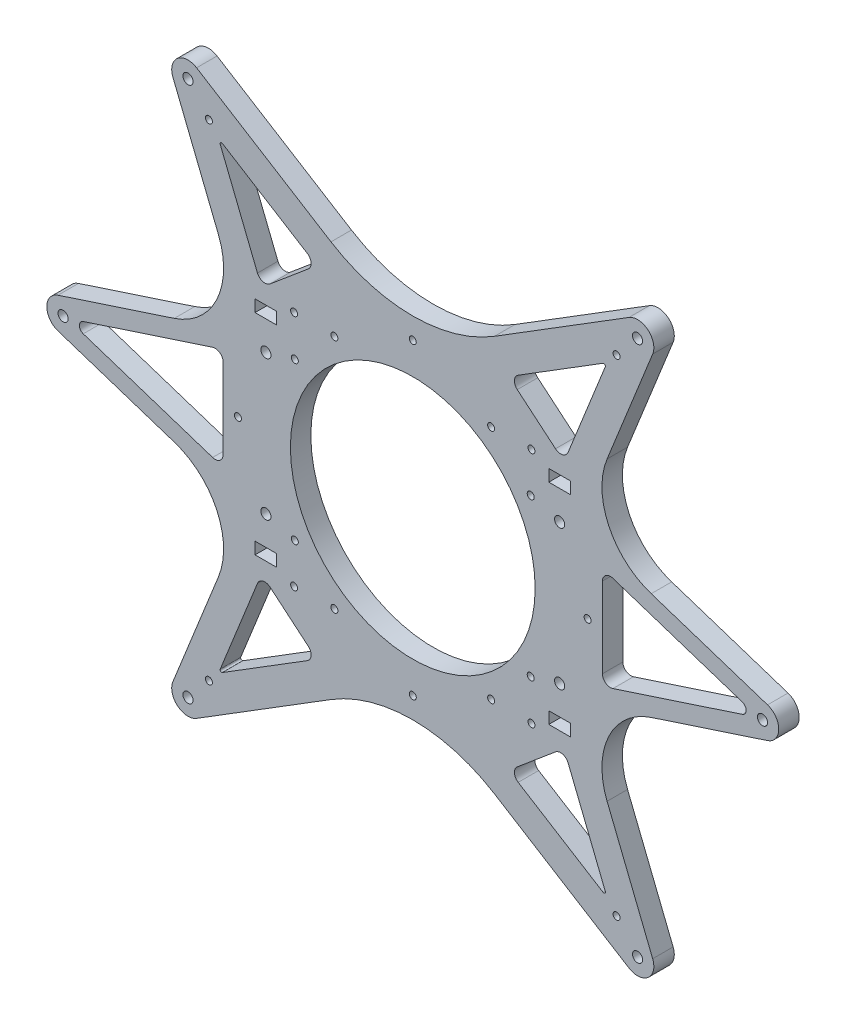
from build123d import *

# Parameters (mm, degrees)
SKETCH1_R           = 1.450000006
SKETCH1_R_2         = 1
SKETCH1_R_3         = 1.45
SKETCH1_R_4         = 35
SKETCH1_W           = 6.2
SKETCH1_H           = 3.4
BOSS_EXTRUDE1_DEPTH = 5.85


with BuildPart() as part:
    # Sketch1 → Boss-Extrude1 (new body)
    with BuildSketch(Plane.XY):
        with BuildLine():
            Line((587.995290395, 497.753361998), (601.026388312, 465.269666287))
            ThreePointArc((601.026388312, 465.269666287), (600.580353033, 449.003385667), (588.406365105, 438.205939183))
            Line((588.406365105, 438.205939183), (555.146182231, 427.30822221))
            ThreePointArc((555.146182231, 427.30822221), (551.939243509, 422.882775531), (555.146182231, 418.457328853))
            Line((555.146182231, 418.457328853), (588.406366938, 407.559611279))
            ThreePointArc((588.406366938, 407.559611279), (600.58035448, 396.762164902), (601.026389221, 380.495884628))
            Line((601.026389221, 380.495884628), (587.995289899, 348.01218948))
            ThreePointArc((587.995289899, 348.01218948), (589.32399836, 342.710908714), (594.775468563, 342.322944064))
            Line((594.775468563, 342.322944064), (633.210915705, 366.208380082))
            ThreePointArc((633.210915705, 366.208380082), (644.436635852, 371.1815144), (656.596182238, 372.882775531))
            ThreePointArc((656.596182238, 372.882775531), (668.755728624, 371.181514399), (679.981448771, 366.208380082))
            Line((679.981448771, 366.208380082), (718.416895913, 342.322944064))
            ThreePointArc((718.416895913, 342.322944064), (723.868366115, 342.710908714), (725.197074576, 348.01218948))
            Line((725.197074576, 348.01218948), (712.165975255, 380.495884628))
            ThreePointArc((712.165975255, 380.495884628), (712.612009996, 396.762164902), (724.785997538, 407.559611279))
            Line((724.785997538, 407.559611279), (758.046182244, 418.457328853))
            ThreePointArc((758.046182244, 418.457328853), (761.253120966, 422.882775531), (758.046182244, 427.30822221))
            Line((758.046182244, 427.30822221), (724.785999371, 438.205939183))
            ThreePointArc((724.785999371, 438.205939183), (712.612011443, 449.003385667), (712.165976164, 465.269666287))
            Line((712.165976164, 465.269666287), (725.197074081, 497.753361998))
            ThreePointArc((725.197074081, 497.753361998), (723.86836572, 503.054641878), (718.416896408, 503.442606583))
            Line((718.416896408, 503.442606583), (679.981448771, 479.557172561))
            ThreePointArc((679.981448771, 479.557172561), (668.755728555, 474.584038083), (656.596182238, 472.882775531))
            ThreePointArc((656.596182238, 472.882775531), (644.436635921, 474.584038083), (633.210915705, 479.557172561))
            Line((633.210915705, 479.557172561), (594.775468067, 503.442606583))
            ThreePointArc((594.775468067, 503.442606583), (589.323998755, 503.054641878), (587.995290395, 497.753361998))
        make_face()
        with Locations((592.317421269, 499.487219843)):
            Circle(SKETCH1_R, mode=Mode.SUBTRACT)
        with Locations((622.655056741, 456.823901028)):
            Circle(SKETCH1_R_2, mode=Mode.SUBTRACT)
        with Locations((614.596182238, 442.882775531)):
            Circle(SKETCH1_R_3, mode=Mode.SUBTRACT)
        with Locations((690.537307735, 456.823901028)):
            Circle(SKETCH1_R_2, mode=Mode.SUBTRACT)
        with Locations((679.012892066, 456.613193858)):
            Circle(SKETCH1_R_2, mode=Mode.SUBTRACT)
        with Locations((556.596182238, 422.882775531)):
            Circle(SKETCH1_R, mode=Mode.SUBTRACT)
        with Locations((690.326600565, 445.299485359)):
            Circle(SKETCH1_R_2, mode=Mode.SUBTRACT)
        with Locations((656.596182238, 422.882775531)):
            Circle(SKETCH1_R_4, mode=Mode.SUBTRACT)
        with Locations((656.596182238, 466.882775531)):
            Circle(SKETCH1_R_2, mode=Mode.SUBTRACT)
        with Locations((714.884162684, 492.347685633)):
            Circle(SKETCH1_R_2, mode=Mode.SUBTRACT)
        with Locations((634.17947241, 389.152357205)):
            Circle(SKETCH1_R_2, mode=Mode.SUBTRACT)
        with Locations((622.655056741, 388.941650034)):
            Circle(SKETCH1_R_2, mode=Mode.SUBTRACT)
        with Locations((592.317421269, 346.278331219)):
            Circle(SKETCH1_R, mode=Mode.SUBTRACT)
        with Locations((622.865763911, 400.466065704)):
            Circle(SKETCH1_R_2, mode=Mode.SUBTRACT)
        with Locations((656.596182238, 378.882775531)):
            Circle(SKETCH1_R_2, mode=Mode.SUBTRACT)
        with Locations((698.596182238, 442.882775531)):
            Circle(SKETCH1_R_3, mode=Mode.SUBTRACT)
        with Locations((698.596182238, 402.882775531)):
            Circle(SKETCH1_R_3, mode=Mode.SUBTRACT)
        with Locations((598.308201792, 353.417865429)):
            Circle(SKETCH1_R_2, mode=Mode.SUBTRACT)
        with Locations((622.865763911, 445.299485359)):
            Circle(SKETCH1_R_2, mode=Mode.SUBTRACT)
        with Locations((634.17947241, 456.613193858)):
            Circle(SKETCH1_R_2, mode=Mode.SUBTRACT)
        with Locations((598.308201792, 492.347685633)):
            Circle(SKETCH1_R_2, mode=Mode.SUBTRACT)
        with Locations((706.596182238, 422.882775531)):
            Circle(SKETCH1_R_2, mode=Mode.SUBTRACT)
        with Locations((679.012892066, 389.152357205)):
            Circle(SKETCH1_R_2, mode=Mode.SUBTRACT)
        with Locations((690.537307735, 388.941650034)):
            Circle(SKETCH1_R_2, mode=Mode.SUBTRACT)
        with Locations((720.874943207, 346.278331219)):
            Circle(SKETCH1_R, mode=Mode.SUBTRACT)
        with Locations((690.326600565, 400.466065704)):
            Circle(SKETCH1_R_2, mode=Mode.SUBTRACT)
        with Locations((714.884162684, 353.417865429)):
            Circle(SKETCH1_R_2, mode=Mode.SUBTRACT)
        with Locations((756.596182238, 422.882775531)):
            Circle(SKETCH1_R, mode=Mode.SUBTRACT)
        with Locations((606.596182238, 422.882775531)):
            Circle(SKETCH1_R_2, mode=Mode.SUBTRACT)
        with Locations((720.874943207, 499.487219843)):
            Circle(SKETCH1_R, mode=Mode.SUBTRACT)
        with Locations((614.596182238, 402.882775531)):
            Circle(SKETCH1_R_3, mode=Mode.SUBTRACT)
        with BuildLine():
            Line((626.454134983, 473.297704221), (602.177707148, 488.384116659))
            ThreePointArc((602.177707148, 488.384116659), (601.664667816, 488.34760519), (601.539622693, 487.848700229))
            Line((601.539622693, 487.848700229), (612.181281174, 461.321357854))
            ThreePointArc((612.181281174, 461.321357854), (613.748321683, 459.954049475), (615.775006462, 460.42062955))
            Line((615.775006462, 460.42062955), (626.717135353, 469.602165866))
            ThreePointArc((626.717135353, 469.602165866), (627.528557146, 471.51703997), (626.454134983, 473.297704221))
        make_face(mode=Mode.SUBTRACT)
        with Locations((698.596182238, 392.882775531)):
            Rectangle(SKETCH1_W, SKETCH1_H, mode=Mode.SUBTRACT)
        with BuildLine():
            Line((686.475229123, 469.602165866), (697.417358014, 460.42062955))
            ThreePointArc((697.417358014, 460.42062955), (699.444042793, 459.954049475), (701.011083302, 461.321357854))
            Line((701.011083302, 461.321357854), (711.652741783, 487.848700229))
            ThreePointArc((711.652741783, 487.848700229), (711.52769666, 488.34760519), (711.014657328, 488.384116659))
            Line((711.014657328, 488.384116659), (686.738229493, 473.297704221))
            ThreePointArc((686.738229493, 473.297704221), (685.663807329, 471.51703997), (686.475229123, 469.602165866))
        make_face(mode=Mode.SUBTRACT)
        with BuildLine():
            Line((562.360059701, 421.35524452), (599.360059701, 409.232174436))
            ThreePointArc((599.360059701, 409.232174436), (601.41475291, 409.553708225), (602.360059701, 411.406150729))
            Line((602.360059701, 411.406150729), (602.360059701, 434.359400333))
            ThreePointArc((602.360059701, 434.359400333), (601.41475291, 436.211842837), (599.360059701, 436.533376627))
            Line((599.360059701, 436.533376627), (562.360059701, 424.410306542))
            ThreePointArc((562.360059701, 424.410306542), (561.253120966, 422.882775531), (562.360059701, 421.35524452))
        make_face(mode=Mode.SUBTRACT)
        with BuildLine():
            Line((601.539622693, 357.916850834), (612.181281174, 384.444193209))
            ThreePointArc((612.181281174, 384.444193209), (613.748321683, 385.811501588), (615.775006462, 385.344921513))
            Line((615.775006462, 385.344921513), (626.717135353, 376.163385196))
            ThreePointArc((626.717135353, 376.163385196), (627.528557146, 374.248511093), (626.454134983, 372.467846842))
            Line((626.454134983, 372.467846842), (602.177707148, 357.381434403))
            ThreePointArc((602.177707148, 357.381434403), (601.664667816, 357.417945872), (601.539622693, 357.916850834))
        make_face(mode=Mode.SUBTRACT)
        with BuildLine():
            Line((686.475229123, 376.163385196), (697.417358014, 385.344921513))
            ThreePointArc((697.417358014, 385.344921513), (699.444042793, 385.811501588), (701.011083302, 384.444193209))
            Line((701.011083302, 384.444193209), (711.652741783, 357.916850834))
            ThreePointArc((711.652741783, 357.916850834), (711.52769666, 357.417945872), (711.014657328, 357.381434403))
            Line((711.014657328, 357.381434403), (686.738229493, 372.467846842))
            ThreePointArc((686.738229493, 372.467846842), (685.663807329, 374.248511093), (686.475229123, 376.163385196))
        make_face(mode=Mode.SUBTRACT)
        with Locations((614.596182238, 452.882775531)):
            Rectangle(SKETCH1_W, SKETCH1_H, mode=Mode.SUBTRACT)
        with Locations((698.596182238, 452.882775531)):
            Rectangle(SKETCH1_W, SKETCH1_H, mode=Mode.SUBTRACT)
        with BuildLine():
            Line((750.832304774, 424.410306542), (713.832304774, 436.533376627))
            ThreePointArc((713.832304774, 436.533376627), (711.777611566, 436.211842837), (710.832304774, 434.359400333))
            Line((710.832304774, 434.359400333), (710.832304774, 411.406150729))
            ThreePointArc((710.832304774, 411.406150729), (711.777611565, 409.553708225), (713.832304774, 409.232174436))
            Line((713.832304774, 409.232174436), (750.832304774, 421.35524452))
            ThreePointArc((750.832304774, 421.35524452), (751.939243509, 422.882775531), (750.832304774, 424.410306542))
        make_face(mode=Mode.SUBTRACT)
        with Locations((614.596182238, 392.882775531)):
            Rectangle(SKETCH1_W, SKETCH1_H, mode=Mode.SUBTRACT)
    extrude(amount=BOSS_EXTRUDE1_DEPTH)


solid = part.part
